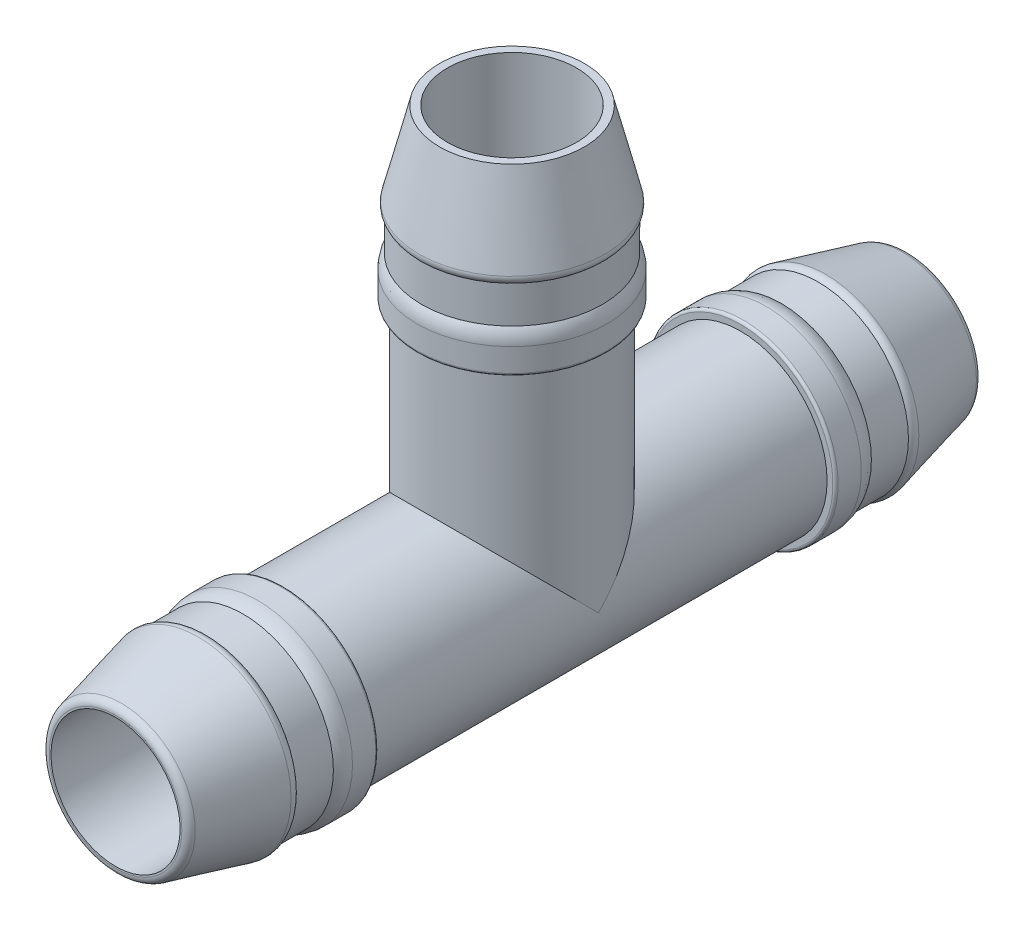
from build123d import *

# Parameters (mm, degrees)
BOSS_EXTRUDE1_DEPTH             = 8.85
BOSS_EXTRUDE1_DEPTH_BACK        = 8.85
SKETCH1_R                       = 3.35
SKETCH2_R                       = 3.675
BOSS_EXTRUDE2_DEPTH             = 2
FILLET1_R                       = 1
SKETCH4_R                       = 3.5
BOSS_EXTRUDE3_DEPTH             = 1
BOSS_EXTRUDE3_DIRECTION_2_REACH = 22.374
SKETCH5_R                       = 3.675
BOSS_EXTRUDE4_DEPTH             = 3.5
BOSS_EXTRUDE4_TAPER             = 14
FILLET2_R                       = 0.3
FILLET3_R                       = 0.1
SKETCH7_R                       = 3.35
BOSS_EXTRUDE5_DEPTH             = 8.85
SKETCH6_R                       = 2.5
CUT_EXTRUDE1_DEPTH              = 33.160816621
SKETCH8_R                       = 3.675
BOSS_EXTRUDE6_DEPTH             = 2
FILLET4_R                       = 1
SKETCH9_R                       = 3.5
BOSS_EXTRUDE7_DEPTH             = 1
BOSS_EXTRUDE7_DIRECTION_2_REACH = 23.45
SKETCH10_R                      = 3.675
BOSS_EXTRUDE8_DEPTH             = 3.5
BOSS_EXTRUDE8_TAPER             = 14
CUT_EXTRUDE2_REACH              = 26.72
CUT_EXTRUDE2_END_RADIUS         = 2.5
SKETCH11_R                      = 2.5
FILLET5_R                       = 0.3
FILLET6_R                       = 0.1


# Read off the part's stored shape, not the designer's step: Mirror1
with BuildPart() as part:
    # Sketch1 → Boss-Extrude1 (new, two sides: drawn at the far end of the back side and taken through both)
    with BuildSketch(Plane.XY.offset(-BOSS_EXTRUDE1_DEPTH_BACK)):
        Circle(SKETCH1_R)
    extrude(amount=BOSS_EXTRUDE1_DEPTH + BOSS_EXTRUDE1_DEPTH_BACK)

    # Sketch2 → Boss-Extrude2 (add)
    with BuildSketch(Plane.XY.offset(8.85)):
        Circle(SKETCH2_R)
    extrude(amount=BOSS_EXTRUDE2_DEPTH)

    # Fillet1
    fillet1_edges = [part.edges().sort_by_distance(p)[0] for p in [
        (-3.675, 0, 10.85),
    ]]
    fillet(fillet1_edges, radius=FILLET1_R)

    # Sketch4 → Boss-Extrude3 (add)
    with BuildSketch(Plane.XY.offset(10.85)):
        Circle(SKETCH4_R)
    extrude(amount=BOSS_EXTRUDE3_DEPTH)

    # Sketch4 → Boss-Extrude3 direction 2 (add, up to next)
    with BuildSketch(Plane.XY.offset(10.85), mode=Mode.PRIVATE) as boss_extrude3_direction_2_sk1:
        Circle(SKETCH4_R)
    boss_extrude3_direction_2_tool1 = extrude(boss_extrude3_direction_2_sk1.sketch, amount=-BOSS_EXTRUDE3_DIRECTION_2_REACH, mode=Mode.PRIVATE) - part.part
    add(boss_extrude3_direction_2_tool1.solids().sort_by_distance((0, 0, 10.85))[0])

    # Sketch5 → Boss-Extrude4 (add)
    with BuildSketch(Plane.XY.offset(11.85)):
        Circle(SKETCH5_R)
    extrude(amount=BOSS_EXTRUDE4_DEPTH, taper=BOSS_EXTRUDE4_TAPER)

    # Fillet2
    # the kernel refuses this fillet: 0.3 mm, written as the material it takes off along each edge
    with BuildSketch(Plane(origin=(0, 0, 11.85), x_dir=(1, 0, 0), z_dir=(0, 1, 0))) as fillet2_piece_1:
        with BuildLine():
            CenterArc((3.308283827, -0.230748584), FILLET2_R, 346, 64.278692047)
            Line((3.599372545, -0.303325153), (3.60519432, -0.304776684))
            Line((3.60519432, -0.304776684), (3.680821774, -0.001451531))
            Line((3.680821774, -0.001451531), (3.675, 0.006))
            ThreePointArc((3.675, 0.006), (3.5875, 0.006), (3.503834323, 0.004614972))
            Line((3.503834323, 0.004614972), (3.5, 0))
        make_face()
    revolve(axis=Axis((0, 0, 11.85), (0, 0, -1)), mode=Mode.SUBTRACT)
    with BuildSketch(Plane(origin=(0, 0, 15.35), x_dir=(1, 0, 0), z_dir=(0, 1, 0))) as fillet2_piece_2:
        with BuildLine():
            CenterArc((2.80235199 - FILLET2_R * 0.781285626507, FILLET2_R), FILLET2_R, 270, 76)
            Line((2.80235199 - FILLET2_R * 0.781285626507, 0), (2.80235199 - FILLET2_R * 0.781285626507, -FILLET2_R * 0.02))
            Line((2.80235199 - FILLET2_R * 0.781285626507, -FILLET2_R * 0.02), (2.80235199 + FILLET2_R * 0.0156257125301, -FILLET2_R * 0.02))
            Line((2.80235199 + FILLET2_R * 0.0156257125301, -FILLET2_R * 0.02), (2.80235199 + FILLET2_R * 0.208416014295, FILLET2_R * 0.753239666488))
            Line((2.80235199 + FILLET2_R * 0.208416014295, FILLET2_R * 0.753239666488), (2.80235199 + FILLET2_R * 0.189010099769, FILLET2_R * 0.7580781044))
        make_face()
    revolve(axis=Axis((0, 0, 15.35), (0, 0, -1)), mode=Mode.SUBTRACT)

    # Fillet3
    fillet3_edges = [part.edges().sort_by_distance(p)[0] for p in [
        (-3.675, 0, 8.85),
    ]]
    fillet(fillet3_edges, radius=FILLET3_R)

    # Mirror1 outline → Mirror1 (revolve)
    with BuildSketch(Plane.XZ):
        with BuildLine():
            ThreePointArc((3.5, -10.415132728), (3.630248659, -10.145803989), (3.675, -9.85))
            Line((3.675, -9.85), (3.675, -8.95))
            ThreePointArc((3.675, -8.95), (3.645710678, -8.879289322), (3.575, -8.85))
            Line((3.575, -8.85), (0, -8.85))
            Line((0, -8.85), (0, -15.35))
            Line((0, -15.35), (2.567966302, -15.35))
            ThreePointArc((2.567966302, -15.35), (2.752664745, -15.286403226), (2.85905502, -15.122576569))
            Line((2.85905502, -15.122576569), (3.599372545, -12.153325153))
            ThreePointArc((3.599372545, -12.153325153), (3.593374476, -11.987349857), (3.5, -11.85))
            Line((3.5, -11.85), (3.5, -10.415132728))
        make_face()
    revolve(axis=Axis((0, 0, 0), (0, 0, 1)))

    # Sketch7 → Boss-Extrude5 (add)
    with BuildSketch(Plane(origin=(0, 0, 0), x_dir=(1, 0, 0), z_dir=(0, 1, 0))):
        Circle(SKETCH7_R)
    extrude(amount=BOSS_EXTRUDE5_DEPTH)

    # Sketch6 → Cut-Extrude1 (cut, through all)
    with BuildSketch(Plane(origin=(0, 0, -15.35), x_dir=(-1, 0, 0), z_dir=(0, 0, -1))):
        Circle(SKETCH6_R)
    extrude(amount=-CUT_EXTRUDE1_DEPTH, mode=Mode.SUBTRACT)

    # Sketch8 → Boss-Extrude6 (add)
    with BuildSketch(Plane(origin=(0, 8.85, 0), x_dir=(1, 0, 0), z_dir=(0, 1, 0))):
        with Locations(Location((0, 0, 0), (0, 0, 270))):
            Circle(SKETCH8_R)
    extrude(amount=BOSS_EXTRUDE6_DEPTH)

    # Fillet4
    fillet4_edges = [part.edges().sort_by_distance(p)[0] for p in [
        (0, 10.85, -3.675),
    ]]
    fillet(fillet4_edges, radius=FILLET4_R)

    # Sketch9 → Boss-Extrude7 (add)
    with BuildSketch(Plane(origin=(0, 10.85, 0), x_dir=(1, 0, 0), z_dir=(0, 1, 0))):
        with Locations(Location((0, 0, 0), (0, 0, 270))):
            Circle(SKETCH9_R)
    extrude(amount=BOSS_EXTRUDE7_DEPTH)

    # Sketch9 → Boss-Extrude7 direction 2 (add, up to next)
    with BuildSketch(Plane(origin=(0, 10.85, 0), x_dir=(1, 0, 0), z_dir=(0, 1, 0)), mode=Mode.PRIVATE) as boss_extrude7_direction_2_sk1:
        with Locations(Location((0, 0, 0), (0, 0, 270))):
            Circle(SKETCH9_R)
    boss_extrude7_direction_2_tool1 = extrude(boss_extrude7_direction_2_sk1.sketch, amount=-BOSS_EXTRUDE7_DIRECTION_2_REACH, mode=Mode.PRIVATE) - part.part
    add(boss_extrude7_direction_2_tool1.solids().sort_by_distance((0, 10.85, 0))[0])

    # Sketch10 → Boss-Extrude8 (add)
    with BuildSketch(Plane(origin=(0, 11.85, 0), x_dir=(1, 0, 0), z_dir=(0, 1, 0))):
        with Locations(Location((0, 0, 0), (0, 0, 270))):
            Circle(SKETCH10_R)
    extrude(amount=BOSS_EXTRUDE8_DEPTH, taper=BOSS_EXTRUDE8_TAPER)

    # Cut-Extrude2: up to this cylinder (the profile starts outside it)
    cut_extrude2_end = Plane(origin=(0, 0, 0), z_dir=(0, 0, -1)) * Cylinder(CUT_EXTRUDE2_END_RADIUS, 59.44, mode=Mode.PRIVATE)
    # Sketch11 → Cut-Extrude2 (cut, up to the surface)
    with BuildSketch(Plane(origin=(0, 15.35, 0), x_dir=(1, 0, 0), z_dir=(0, 1, 0)), mode=Mode.PRIVATE) as cut_extrude2_sk1:
        with Locations(Location((0, 0, 0), (0, 0, 270))):
            Circle(SKETCH11_R)
    cut_extrude2_tool1 = extrude(cut_extrude2_sk1.sketch, amount=-CUT_EXTRUDE2_REACH, mode=Mode.PRIVATE) - cut_extrude2_end
    add(cut_extrude2_tool1.solids().sort_by_distance((0, 15.35, 0))[0], mode=Mode.SUBTRACT)

    # Fillet5
    # the kernel refuses this fillet: 0.3 mm, written as the material it takes off along each edge
    with BuildSketch(Plane(origin=(0, 11.85, 0), x_dir=(0, 0, 1), z_dir=(-1, 0, 0))) as fillet5_piece_1:
        with BuildLine():
            CenterArc((3.308283827, 0.230748584), FILLET5_R, 309.721307953, 64.278692047)
            Line((3.5, 0), (3.503834323, -0.004614972))
            ThreePointArc((3.503834323, -0.004614972), (3.5875, -0.006), (3.675, -0.006))
            Line((3.675, -0.006), (3.680821774, 0.001451531))
            Line((3.680821774, 0.001451531), (3.60519432, 0.304776684))
            Line((3.60519432, 0.304776684), (3.599372545, 0.303325153))
        make_face()
    revolve(axis=Axis((0, 11.85, 0), (0, 1, 0)), mode=Mode.SUBTRACT)

    # Fillet6
    fillet6_edges = [part.edges().sort_by_distance(p)[0] for p in [
        (0, 8.85, -3.675),
    ]]
    fillet(fillet6_edges, radius=FILLET6_R)


solid = part.part
